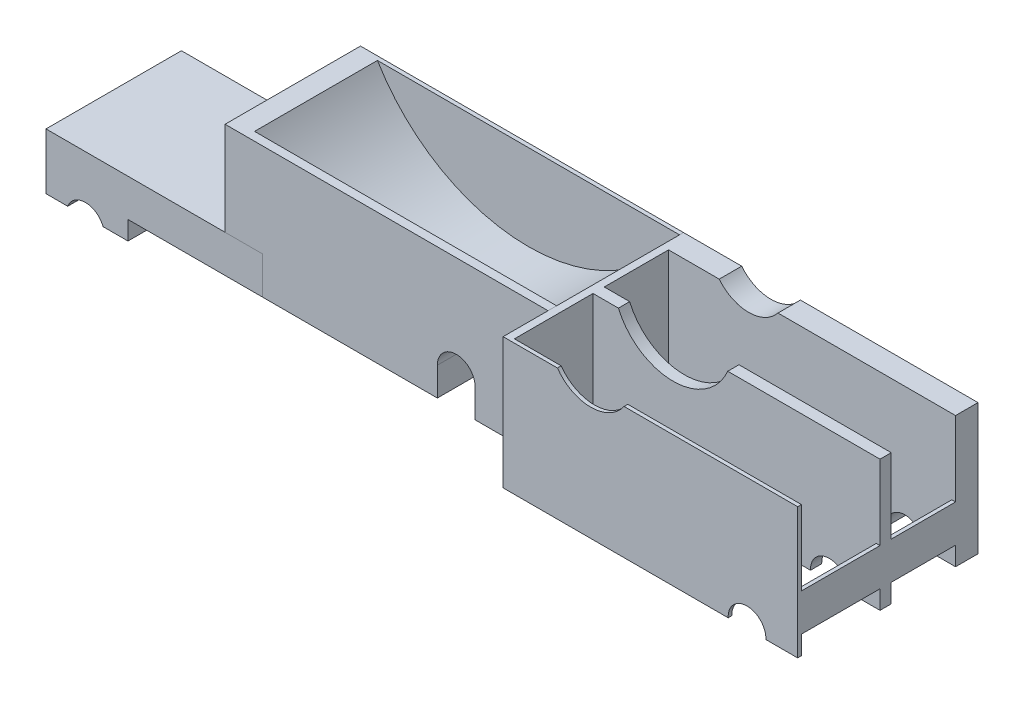
from build123d import *

# Parameters (mm, degrees)
SKETCH1_W           = 419.1
SKETCH1_H           = 142.18412
BOSS_EXTRUDE1_DEPTH = 88.9
SKETCH2_R           = 119.38
CUT_EXTRUDE1_DEPTH  = 83.4009
SKETCH7_W           = 194.780719179
SKETCH7_H           = 43.63974
SKETCH7_H_2         = 53.35016
CUT_EXTRUDE2_DEPTH  = 452.402640644
SKETCH4_R           = 40.386
CUT_EXTRUDE4_DEPTH  = 10
SKETCH18_R          = 25.527
CUT_EXTRUDE11_DEPTH = 23.09114
SKETCH5_R           = 27.686
CUT_EXTRUDE5_DEPTH  = 14.48308
SKETCH8_W           = 419.1
SKETCH8_H           = 88.9
CUT_EXTRUDE6_DEPTH  = 7.85114
SKETCH9_W           = 419.1
SKETCH9_H           = 88.9
CUT_EXTRUDE7_DEPTH  = 11.94308
SKETCH10_W          = 219.202
SKETCH10_H          = 88.9
CUT_EXTRUDE8_DEPTH  = 30.48
SKETCH12_W          = 121.533574186
SKETCH12_H          = 91.9099
BOSS_EXTRUDE2_DEPTH = 25.4
SKETCH14_W          = 55.647095764
SKETCH14_H          = 91.9099
BOSS_EXTRUDE3_DEPTH = 12.7
SKETCH17_R          = 12.827
CUT_EXTRUDE10_DEPTH = 446.564033133
SKETCH20_W          = 2.54
SKETCH20_H          = 25.4
BOSS_EXTRUDE4_DEPTH = 104.6099
SPLIT2_START        = -121.533574186
SPLIT2_DEPTH        = 340.735574186
SPLIT2_START_2      = -134.33298
SPLIT2_2_DEPTH      = 91.9099
SPLIT2_START_3      = -48.23206
SPLIT2_3_DEPTH      = 5.80898
SPLIT2_4_DEPTH      = 2.70002
SPLIT2_5_DEPTH      = 91.9099


# Read off the part's stored shape, not the designer's step: Split2
with BuildPart() as part:
    # Sketch1 → Boss-Extrude1 (new body)
    with BuildSketch(Plane(origin=(0, 0, 0), x_dir=(1, 0, 0), z_dir=(0, 1, 0))):
        with Locations((209.55, 71.09206)):
            Rectangle(SKETCH1_W, SKETCH1_H)
    extrude(amount=BOSS_EXTRUDE1_DEPTH)

    # Sketch2 → Cut-Extrude1 (cut)
    with BuildSketch(Plane(origin=(0, 0, -131.63296), x_dir=(-1, 0, 0), z_dir=(0, 0, -1))):
        with Locations((-116.7166499, 150.061217688)):
            Circle(SKETCH2_R)
    extrude(amount=-CUT_EXTRUDE1_DEPTH, mode=Mode.SUBTRACT)

    # Sketch7 → Cut-Extrude2 (cut, through all)
    with BuildSketch(Plane(origin=(0, 88.9, 0), x_dir=(1, 0, 0), z_dir=(0, 1, 0))):
        with Locations((321.709640411, 97.27311)):
            Rectangle(SKETCH7_W, SKETCH7_H)
        with Locations((321.709640411, 41.15816)):
            Rectangle(SKETCH7_W, SKETCH7_H_2)
    extrude(amount=-CUT_EXTRUDE2_DEPTH, mode=Mode.SUBTRACT)

    # Sketch4 → Cut-Extrude4 (cut)
    with BuildSketch(Plane(origin=(0, 0, -67.83324), x_dir=(-1, 0, 0), z_dir=(0, 0, -1))):
        with Locations((-278.649352085, 104.852009966)):
            Circle(SKETCH4_R)
    extrude(amount=CUT_EXTRUDE4_DEPTH, mode=Mode.SUBTRACT)

    # Sketch18 → Cut-Extrude11 (cut)
    with BuildSketch(Plane(origin=(0, 0, -142.18412), x_dir=(-1, 0, 0), z_dir=(0, 0, -1))):
        with Locations((-278.649352085, 104.852009966)):
            Circle(SKETCH18_R)
    extrude(amount=-CUT_EXTRUDE11_DEPTH, mode=Mode.SUBTRACT)

    # Sketch5 → Cut-Extrude5 (cut)
    with BuildSketch(Plane(origin=(0, 0, -14.48308), x_dir=(-1, 0, 0), z_dir=(0, 0, -1))):
        with Locations((-278.649352085, 104.852009966)):
            Circle(SKETCH5_R)
    extrude(amount=-CUT_EXTRUDE5_DEPTH, mode=Mode.SUBTRACT)

    # Sketch8 → Cut-Extrude6 (cut)
    with BuildSketch(Plane(origin=(0, 0, -142.18412), x_dir=(-1, 0, 0), z_dir=(0, 0, -1))):
        with Locations((-209.55, 44.45)):
            Rectangle(SKETCH8_W, SKETCH8_H)
    extrude(amount=-CUT_EXTRUDE6_DEPTH, mode=Mode.SUBTRACT)

    # Sketch9 → Cut-Extrude7 (cut)
    with BuildSketch(Plane.XY):
        with Locations((209.55, 44.45)):
            Rectangle(SKETCH9_W, SKETCH9_H)
    extrude(amount=-CUT_EXTRUDE7_DEPTH, mode=Mode.SUBTRACT)

    # Sketch10 → Cut-Extrude8 (cut)
    with BuildSketch(Plane.XY.offset(-11.94308)):
        with Locations((109.601, 44.45)):
            Rectangle(SKETCH10_W, SKETCH10_H)
    extrude(amount=-CUT_EXTRUDE8_DEPTH, mode=Mode.SUBTRACT)

    # Sketch12 → Boss-Extrude2 (add)
    with BuildSketch(Plane.XZ):
        with Locations((-60.766787093, -88.37803)):
            Rectangle(SKETCH12_W, SKETCH12_H)
    extrude(amount=-BOSS_EXTRUDE2_DEPTH)

    # Sketch14 → Boss-Extrude3 (add)
    with BuildSketch(Plane.XZ):
        with Locations((-93.710026304, -88.37803)):
            Rectangle(SKETCH14_W, SKETCH14_H)
    extrude(amount=BOSS_EXTRUDE3_DEPTH)

    # Sketch17 → Cut-Extrude10 (cut, through all)
    with BuildSketch(Plane(origin=(0, 0, -134.33298), x_dir=(-1, 0, 0), z_dir=(0, 0, -1))):
        with Locations((-384.735935495, 0.531880938)):
            Circle(SKETCH17_R)
        with Locations((94.798916194, -17.274045482)):
            Circle(SKETCH17_R)
        with BuildLine():
            Line((-169.736021607, 19.31637742), (-169.736021607, 0))
            Line((-169.736021607, 0), (-144.082021607, 0))
            Line((-144.082021607, 0), (-144.082021607, 19.31637742))
            ThreePointArc((-144.082021607, 19.31637742), (-156.909021607, 32.14337742), (-169.736021607, 19.31637742))
        make_face()
    extrude(amount=-CUT_EXTRUDE10_DEPTH, mode=Mode.SUBTRACT)

    # Sketch20 → Boss-Extrude4 (add)
    with BuildSketch(Plane(origin=(0, 0, -14.48308), x_dir=(-1, 0, 0), z_dir=(0, 0, -1))):
        with Locations((-417.83, 25.4)):
            Rectangle(SKETCH20_W, SKETCH20_H)
    extrude(amount=BOSS_EXTRUDE4_DEPTH)

    # Split2 outline → Split2 (cut)
    with BuildSketch(Plane.YZ.offset(SPLIT2_START)):
        Polygon((-12.7, -42.42308), (-12.7, -134.33298), (88.9, -134.33298), (88.9, -131.63296), (88.9, -48.23206), (88.9, -42.42308), align=None)
    extrude(amount=SPLIT2_DEPTH, mode=Mode.SUBTRACT)


with BuildPart() as body_2:
    # Split2 2 outline → Split2 2 (new body)
    with BuildSketch(Plane.XY.offset(SPLIT2_START_2)):
        with BuildLine():
            Line((219.202, 0), (219.202, 88.837550574))
            ThreePointArc((219.202, 88.837550574), (116.680284427, 30.681223227), (14.194018979, 88.9))
            Line((14.194018979, 88.9), (0, 88.9))
            Line((0, 88.9), (0, 25.4))
            Line((0, 25.4), (25.4, 25.4))
            Line((25.4, 25.4), (25.4, 0))
            Line((25.4, 0), (144.082021607, 0))
            Line((144.082021607, 0), (144.082021607, 19.31637742))
            ThreePointArc((144.082021607, 19.31637742), (156.909021607, 32.14337742), (169.736021607, 19.31637742))
            Line((169.736021607, 19.31637742), (169.736021607, 0))
            Line((169.736021607, 0), (219.202, 0))
        make_face()
    extrude(amount=SPLIT2_2_DEPTH)

    # Split2 3 outline → Split2 3 (add)
    with BuildSketch(Plane.XY.offset(SPLIT2_START_3)):
        with BuildLine():
            Line((219.202, 88.837550574), (219.202, 88.9))
            Line((219.202, 88.9), (14.194018979, 88.9))
            ThreePointArc((14.194018979, 88.9), (116.680284427, 30.681223227), (219.202, 88.837550574))
        make_face()
    extrude(amount=SPLIT2_3_DEPTH)

    # Split2 4 outline → Split2 4 (add)
    with BuildSketch(Plane.XY.offset(SPLIT2_START_2)):
        with BuildLine():
            Line((219.202, 88.837550574), (219.202, 88.9))
            Line((219.202, 88.9), (14.194018979, 88.9))
            ThreePointArc((14.194018979, 88.9), (116.680284427, 30.681223227), (219.202, 88.837550574))
        make_face()
    extrude(amount=SPLIT2_4_DEPTH)


with BuildPart() as body_3:
    # Split2 5 outline → Split2 5 (new body)
    with BuildSketch(Plane.XY.offset(SPLIT2_START_2)):
        with BuildLine():
            Line((25.4, 0), (25.4, 25.4))
            Line((25.4, 25.4), (-121.533574186, 25.4))
            Line((-121.533574186, 25.4), (-121.533574186, -12.7))
            Line((-121.533574186, -12.7), (-106.782656717, -12.7))
            ThreePointArc((-106.782656717, -12.7), (-94.798916194, -4.447045482), (-82.815175671, -12.7))
            Line((-82.815175671, -12.7), (-65.886478422, -12.7))
            Line((-65.886478422, -12.7), (-65.886478422, 0))
            Line((-65.886478422, 0), (25.4, 0))
        make_face()
    extrude(amount=SPLIT2_5_DEPTH)


solid = Compound([part.part, body_2.part, body_3.part])
